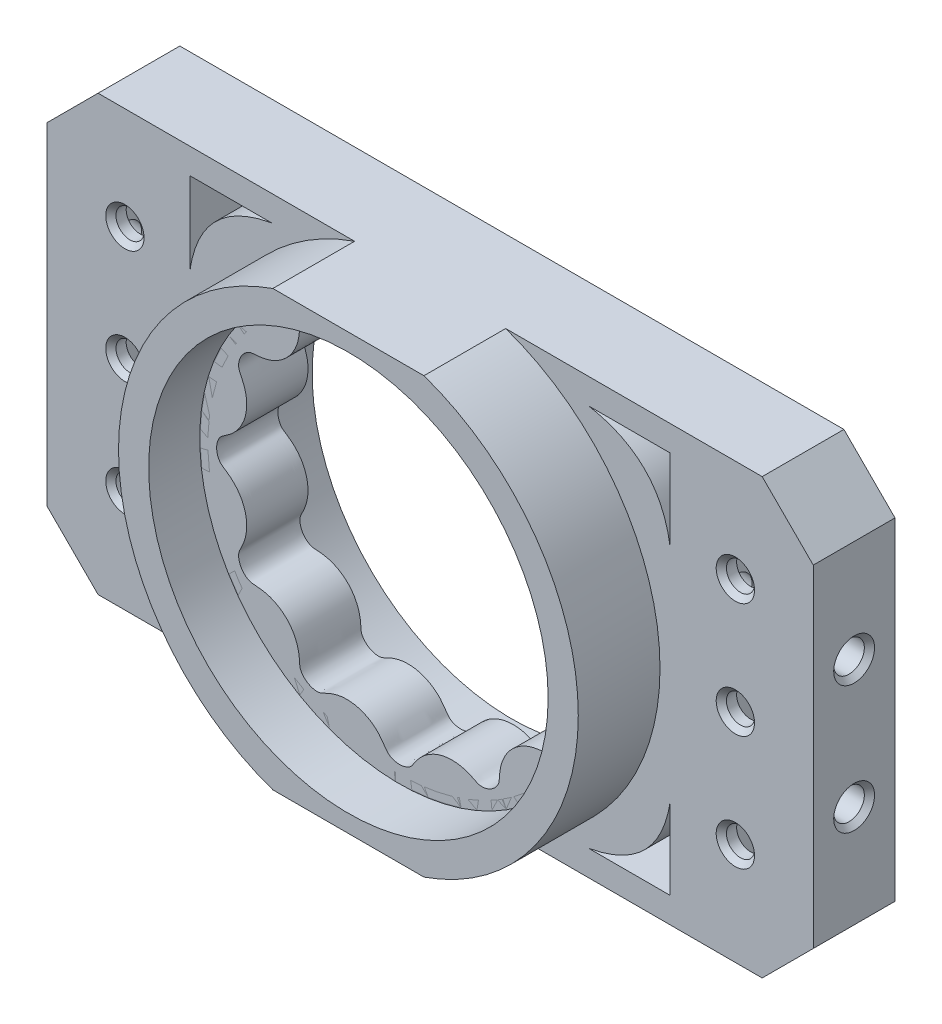
from build123d import *

# Parameters (mm, degrees)
ESQUISSE1_W              = 150
ESQUISSE1_H              = 85
ESQUISSE1_R              = 39.1
BOSS_EXTRU_2_DEPTH       = 32
ESQUISSE3_R              = 39.1
BOSS_EXTRU_3_DEPTH       = 12
ESQUISSE4_R              = 39
ESQUISSE4_R_2            = 37.5
BOSS_EXTRU_4_DEPTH       = 12
ENL_V_MAT_EXTRU_2_DEPTH  = 16
CHANFREIN1_SIZE          = 10
ESQUISSE8_W              = 15.5
ESQUISSE8_H              = 70
ENL_V_MAT_EXTRU_4_DEPTH  = 13
ESQUISSE10_R             = 2.75
ENL_V_MAT_EXTRU_5_DEPTH  = 11
ESQUISSE11_R             = 3
ENL_V_MAT_EXTRU_6_DEPTH  = 29
ENL_V_START              = -29
ESQUISSE12_R             = 3
ENL_V_MAT_EXTRU_7_DEPTH  = 29
CHANFREIN3_SIZE          = 1
ESQUISSE13_R             = 2
ENL_V_MAT_EXTRU_8_DEPTH  = 10
ENL_V_MAT_EXTRU_9_DEPTH  = 37
ENL_V_START_2            = -12
ENL_V_MAT_EXTRU_10_DEPTH = 12


# Read off the part's stored shape, not the designer's step: Enlèv. mat.-Extru.10
with BuildPart() as part:
    # Esquisse1 → Boss.-Extru.2 (new body)
    with BuildSketch(Plane.XY):
        Rectangle(ESQUISSE1_W, ESQUISSE1_H)
        Circle(ESQUISSE1_R, mode=Mode.SUBTRACT)
    extrude(amount=BOSS_EXTRU_2_DEPTH)

    # Esquisse7 → Enlèv. mat.-Extru.2 (cut)
    with BuildSketch(Plane.XY.offset(32)):
        with BuildLine():
            Line((14.790199458, 42.5), (75, 42.5))
            Line((75, 42.5), (75, -42.5))
            Line((75, -42.5), (14.790199458, -42.5))
            ThreePointArc((14.790199458, -42.5), (45, 0), (14.790199458, 42.5))
        make_face()
        with BuildLine():
            Line((-75, 42.5), (-14.790199458, 42.5))
            ThreePointArc((-14.790199458, 42.5), (-45, 0), (-14.790199458, -42.5))
            Line((-14.790199458, -42.5), (-75, -42.5))
            Line((-75, -42.5), (-75, 42.5))
        make_face()
    extrude(amount=-ENL_V_MAT_EXTRU_2_DEPTH, mode=Mode.SUBTRACT)

    # Chanfrein1
    chanfrein1_edges = [part.edges().sort_by_distance(p)[0] for p in [
        (-75, -42.5, 8),
        (-75, 42.5, 8),
        (75, 42.5, 8),
        (75, -42.5, 8),
    ]]
    chamfer(chanfrein1_edges, length=CHANFREIN1_SIZE)

    # Esquisse8 → Enlèv. mat.-Extru.4 (cut)
    with BuildSketch(Plane(origin=(0, 0, 0), x_dir=(-1, 0, 0), z_dir=(0, 0, -1))):
        with Locations((-59.75, 0)):
            Rectangle(ESQUISSE8_W, ESQUISSE8_H)
        with Locations((59.75, 0)):
            Rectangle(ESQUISSE8_W, ESQUISSE8_H)
    extrude(amount=-ENL_V_MAT_EXTRU_4_DEPTH, mode=Mode.SUBTRACT)

    # Esquisse10 → Enlèv. mat.-Extru.5 (cut)
    with BuildSketch(Plane(origin=(0, 0, 13), x_dir=(-1, 0, 0), z_dir=(0, 0, -1))):
        with Locations((-59.75, 22.5)):
            Circle(ESQUISSE10_R)
        with Locations((-59.75, 0)):
            Circle(ESQUISSE10_R)
        with Locations(Location((-59.75, -22.5, 0), (0, 0, 180))):
            Circle(ESQUISSE10_R)
        with Locations(Location((59.75, 22.5, 0), (0, 0, 180))):
            Circle(ESQUISSE10_R)
        with Locations(Location((59.75, 0, 0), (0, 0, 180))):
            Circle(ESQUISSE10_R)
        with Locations((59.75, -22.5)):
            Circle(ESQUISSE10_R)
    extrude(amount=-ENL_V_MAT_EXTRU_5_DEPTH, mode=Mode.SUBTRACT)

    # Esquisse11 → Enlèv. mat.-Extru.6 (cut)
    with BuildSketch(Plane(origin=(75, 0, 0), x_dir=(0, 0, -1), z_dir=(1, 0, 0))):
        with Locations(Location((-8, 12.5, 0), (0, 0, 90))):
            Circle(ESQUISSE11_R)
        with Locations(Location((-8, -12.5, 0), (0, 0, 90))):
            Circle(ESQUISSE11_R)
    extrude(amount=-ENL_V_MAT_EXTRU_6_DEPTH, mode=Mode.SUBTRACT)

    # Esquisse12 → Enlèv. mat.-Extru.7 (cut)
    with BuildSketch(Plane.ZY.offset(75).offset(ENL_V_START)):
        with Locations(Location((8, 12.5, 0), (0, 0, 90))):
            Circle(ESQUISSE12_R)
        with Locations(Location((8, -12.5, 0), (0, 0, 90))):
            Circle(ESQUISSE12_R)
    extrude(amount=ENL_V_MAT_EXTRU_7_DEPTH, mode=Mode.SUBTRACT)

    # Chanfrein3
    chanfrein3_edges = [part.edges().sort_by_distance(p)[0] for p in [
        (62.5, 0, 16),
        (57, -22.5, 16),
        (-62.5, 22.5, 16),
        (-62.5, 0, 16),
        (-57, -22.5, 16),
        (62.5, 22.5, 16),
        (75, 9.5, 8),
        (75, -15.5, 8),
        (-75, 9.5, 8),
        (-75, -15.5, 8),
    ]]
    chamfer(chanfrein3_edges, length=CHANFREIN3_SIZE)

    # Esquisse13 → Enlèv. mat.-Extru.8 (cut)
    with BuildSketch(Plane(origin=(0, 0, 0), x_dir=(-1, 0, 0), z_dir=(0, 0, -1))):
        with Locations((-47.299047409, 0.206340622)):
            Circle(ESQUISSE13_R)
        with Locations((47.299047409, -0.206340622)):
            Circle(ESQUISSE13_R)
    extrude(amount=-ENL_V_MAT_EXTRU_8_DEPTH, mode=Mode.SUBTRACT)

    # Esquisse14 → Enlèv. mat.-Extru.9 (cut)
    with BuildSketch(Plane(origin=(0, 0, 0), x_dir=(-1, 0, 0), z_dir=(0, 0, -1))):
        with BuildLine():
            Line((-47, 37.5), (-31, 37.5))
            add(Edge.make_bspline(
                [(-47, 21.5), (-45, 35), (-31, 37.5)],
                knots=[0, 0, 0, 0.553542999, 0.553542999, 0.553542999], degree=2))
            Line((-47, 21.5), (-47, 37.5))
        make_face()
        with BuildLine():
            Line((-47, -37.5), (-31, -37.5))
            add(Edge.make_bspline(
                [(-47, -21.5), (-45, -35), (-31, -37.5)],
                knots=[0, 0, 0, 0.553542999, 0.553542999, 0.553542999], degree=2))
            Line((-47, -21.5), (-47, -37.5))
        make_face()
        with BuildLine():
            Line((47, -37.5), (47, -21.5))
            add(Edge.make_bspline(
                [(47, -21.5), (45, -35), (31, -37.5)],
                knots=[0, 0, 0, 0.553542999, 0.553542999, 0.553542999], degree=2))
            Line((31, -37.5), (47, -37.5))
        make_face()
        with BuildLine():
            Line((47, 37.5), (31, 37.5))
            add(Edge.make_bspline(
                [(47, 21.5), (45, 35), (31, 37.5)],
                knots=[0, 0, 0, 0.553542999, 0.553542999, 0.553542999], degree=2))
            Line((47, 21.5), (47, 37.5))
        make_face()
    extrude(amount=-ENL_V_MAT_EXTRU_9_DEPTH, mode=Mode.SUBTRACT)


with BuildPart() as body_2:
    # Esquisse3 → Boss.-Extru.3 (new body)
    with BuildSketch(Plane.XY.offset(10)):
        Circle(ESQUISSE3_R)
    extrude(amount=BOSS_EXTRU_3_DEPTH)

    # Enlèv. mat.-Extru.10 outline → Enlèv. mat.-Extru.10 (cut)
    with BuildSketch(Plane.XY.offset(22).offset(ENL_V_START_2)):
        with BuildLine():
            Line((35.789890768, -0.029077947), (35.79, 0))
            add(Edge.make_bspline(
                [(35.79, 0), (35.79, 0.127639257), (35.778773221, 0.332778615), (35.751800956, 0.550165303), (35.708661066, 0.806297374), (35.637092462, 1.089154863), (35.518929188, 1.420366645), (35.377797584, 1.713768291), (35.247271338, 1.925540597), (35.137539018, 2.07532933), (35.057864121, 2.172252362), (34.9697529, 2.268034114), (34.891049162, 2.344192302), (34.801897946, 2.421729875), (34.69946496, 2.501431646), (34.596030594, 2.575439949), (34.500719143, 2.640565416), (34.318289008, 2.760845312), (34.02375405, 2.954451504), (33.701874887, 3.177905887), (33.383346306, 3.408429746), (32.981888377, 3.733470258), (32.531197085, 4.133377044), (31.871067649, 4.796975418), (31.068067937, 5.947587573), (30.472373317, 7.133452491), (30.061603701, 8.481846392), (29.888749816, 9.803379457), (29.914580672, 10.998511079), (30.102609971, 12.237438542), (30.382060144, 13.143621741), (30.636801119, 13.792630936), (30.816186498, 14.187427774), (30.943376886, 14.451879211), (31.0689779, 14.704292097), (31.161104553, 14.887140556), (31.2318527, 15.032338739), (31.278096351, 15.132052587), (31.323132219, 15.235489538), (31.362248496, 15.336628462), (31.398692502, 15.448320134), (31.429003266, 15.562819921), (31.454028522, 15.684822556), (31.479702439, 15.858919885), (31.495635281, 16.099637434), (31.482672589, 16.416961113), (31.433749716, 16.753910576), (31.34708099, 17.100368066), (31.181426931, 17.562942897), (30.943240717, 18.009153182), (30.647260345, 18.409401982), (30.402285687, 18.680583556), (30.14127001, 18.917288139), (29.872471771, 19.11533163), (29.605887647, 19.271728853), (29.393589263, 19.367188973), (29.234529458, 19.423681926), (29.119044093, 19.457587012), (29.003119698, 19.484459665), (28.906210279, 19.501477295), (28.806535958, 19.514652758), (28.714282036, 19.5244974), (28.592052543, 19.534654342), (28.42338179, 19.545849621), (28.172284799, 19.559711481), (27.832755677, 19.582540906), (27.466980271, 19.615253244), (26.929513883, 19.678606682), (26.007949438, 19.859369436), (24.480873664, 20.32540815), (22.133767779, 21.835393957), (20.769553097, 23.717778361), (20.188745435, 25.008264309), (19.863427201, 25.99165496), (19.699659602, 26.804732782), (19.62072513, 27.405174555), (19.586431757, 27.785673237), (19.561270963, 28.142953682), (19.54704536, 28.404004221), (19.535490733, 28.579954578), (19.524972142, 28.70930536), (19.5153958, 28.800535112), (19.502752617, 28.897829516), (19.484875266, 29.001211669), (19.458858121, 29.114046792), (19.425241788, 29.22977198), (19.369024421, 29.389032777), (19.274379562, 29.600724405), (19.11875834, 29.867272371), (18.921506453, 30.136098434), (18.68549984, 30.397370908), (18.414950793, 30.642712051), (18.015371832, 30.939368383), (17.569580645, 31.178417899), (17.107108897, 31.345029218), (16.760554766, 31.432432917), (16.423340885, 31.482075198), (16.10552067, 31.495704603), (15.864311796, 31.480249261), (15.689680439, 31.454878917), (15.567439252, 31.430085323), (15.452573139, 31.399939552), (15.341189665, 31.363875073), (15.240261721, 31.325068493), (15.138894908, 31.281156682), (15.041278656, 31.236131671), (14.900097358, 31.167410075), (14.689678306, 31.062100064), (14.354835126, 30.893629354), (13.865243952, 30.668960177), (13.272972598, 30.428393217), (12.425347818, 30.15426356), (11.326281988, 29.953102301), (9.82258172, 29.849558178), (7.95986682, 30.135810078), (6.293648235, 30.868825703), (4.988230142, 31.703300007), (4.090869453, 32.560781852), (3.527967775, 33.225694405), (3.220050937, 33.641187129), (2.955599108, 34.021355477), (2.775563917, 34.297067147), (2.658750246, 34.473498073), (2.579075117, 34.590483775), (2.499833919, 34.701526095), (2.426476608, 34.796198343), (2.350145031, 34.884566755), (2.267482311, 34.970231929), (2.178034627, 35.052870462), (2.078668721, 35.134895634), (1.930920344, 35.243676206), (1.719281302, 35.374895996), (1.425877786, 35.516393683), (1.100164649, 35.634098935), (0.63289154, 35.75181763), (0.007401252, 35.81466098), (-0.618690388, 35.754165123), (-1.086953523, 35.638110645), (-1.413833808, 35.521429897), (-1.708608833, 35.380734486), (-1.921589084, 35.249899691), (-2.070392386, 35.141317841), (-2.170861559, 35.059121469), (-2.261050712, 34.976483283), (-2.343304938, 34.892068534), (-2.421254458, 34.802491622), (-2.492418477, 34.711457355), (-2.567715082, 34.606717765), (-2.644312458, 34.494894578), (-2.754751516, 34.328819924), (-2.915999601, 34.081599588), (-3.146975811, 33.744763494), (-3.416581941, 33.370331804), (-3.882758231, 32.799274615), (-4.720392282, 31.910394851), (-6.316892237, 30.800843837), (-8.024209241, 30.17283188), (-9.412330545, 29.914545771), (-10.677673335, 29.891721388), (-11.98007126, 30.042533549), (-12.814391996, 30.278561565), (-13.355852179, 30.465819904), (-13.813307943, 30.646708344), (-14.255420974, 30.847002461), (-14.626366422, 31.029030956), (-14.895539037, 31.165105725), (-15.027898274, 31.229975475), (-15.117098477, 31.271526259), (-15.226844092, 31.319562608), (-15.336650035, 31.362189146), (-15.445017017, 31.397732004), (-15.555219431, 31.427227275), (-15.680827522, 31.45329776), (-15.854573681, 31.479259788), (-16.092675439, 31.495510304), (-16.411211703, 31.483226588), (-16.746987126, 31.435092935), (-17.093637231, 31.349123817), (-17.556369229, 31.184378261), (-18.114604594, 30.887875604), (-18.596491022, 30.494229721), (-18.912934407, 30.14655411), (-19.112191918, 29.877249569), (-19.268894828, 29.611333834), (-19.364897726, 29.399157094), (-19.422831966, 29.237286254), (-19.456665107, 29.122612158), (-19.482308097, 29.013490513), (-19.500982775, 28.90854568), (-19.514721442, 28.806692535), (-19.524489857, 28.716275072), (-19.532889269, 28.617578468), (-19.543936891, 28.450532931), (-19.558187597, 28.188953448), (-19.581617308, 27.853371052), (-19.605689052, 27.563389815), (-19.665938994, 27.023408918), (-19.815911629, 26.184793134), (-20.157318959, 25.004337248), (-20.843954437, 23.653848589), (-21.907442667, 22.173569415), (-23.366068199, 20.981254776), (-24.729875334, 20.299797727), (-25.809319409, 19.908550701), (-26.681320067, 19.720412005), (-27.329223187, 19.628680558), (-27.736877407, 19.590346612), (-28.112211774, 19.563014677), (-28.382726945, 19.548308881), (-28.571483796, 19.536082551), (-28.700131212, 19.525824509), (-28.79357287, 19.516211471), (-28.89378403, 19.503380006), (-28.996103178, 19.485881398), (-29.10987875, 19.459951447), (-29.225176726, 19.426706738), (-29.34451178, 19.384879841), (-29.468665803, 19.333436849), (-29.640172161, 19.251114123), (-29.861998465, 19.122204031), (-30.130954944, 18.925694153), (-30.392436134, 18.690413161), (-30.638152972, 18.420492386), (-30.935488982, 18.021575487), (-31.175393775, 17.576220092), (-31.34296248, 17.113849239), (-31.431102317, 16.767207226), (-31.481463681, 16.42971509), (-31.4957654, 16.111462267), (-31.480769426, 15.869602066), (-31.455756173, 15.694752007), (-31.431086617, 15.571759024), (-31.40127822, 15.457172944), (-31.36534065, 15.345320051), (-31.327156613, 15.245460908), (-31.284090449, 15.145446195), (-31.239676797, 15.048766117), (-31.175818718, 14.917264592), (-31.068186275, 14.701173957), (-30.917280913, 14.403594033), (-30.696544325, 13.926689145), (-30.472211568, 13.390878907), (-30.15950348, 12.456530632), (-29.810946142, 10.730225838), (-30.064689862, 7.899926921), (-31.318948675, 5.426682654), (-32.435505386, 4.20878597), (-33.13999565, 3.59521888), (-33.584832875, 3.260315014), (-33.997977, 2.970889914), (-34.26821336, 2.794741742), (-34.465534156, 2.66394032), (-34.583531573, 2.583900852), (-34.697391976, 2.502995303), (-34.790793135, 2.430824615), (-34.882336437, 2.352216562), (-34.966665648, 2.271100102), (-35.049545251, 2.181842203), (-35.131851143, 2.082557104), (-35.240493763, 1.93564611), (-35.372005815, 1.724543039), (-35.513839403, 1.431924113), (-35.632092679, 1.106708259), (-35.750617163, 0.640010532), (-35.814640989, 0.014763145), (-35.755322825, -0.611565711), (-35.640088635, -1.080369209), (-35.523946323, -1.407769949), (-35.383629297, -1.703270447), (-35.253013755, -1.916896218), (-35.144474765, -2.066297321), (-35.062389745, -2.167084178), (-34.979546359, -2.25788197), (-34.895587666, -2.340059563), (-34.806035847, -2.418326934), (-34.716245766, -2.48880254), (-34.613711332, -2.562791766), (-34.505156163, -2.637397458), (-34.344561813, -2.744409737), (-34.110801882, -2.896806323), (-33.787525171, -3.117036587), (-33.441500377, -3.36430582), (-32.904011705, -3.79028071), (-32.210945892, -4.431178925), (-31.446053197, -5.377937961), (-30.607991425, -6.72355325), (-29.997666198, -8.529921388), (-29.878015885, -10.308985872), (-29.991732291, -11.746712679), (-30.285047246, -12.865829628), (-30.568457782, -13.632179159), (-30.775906261, -14.100407706), (-30.896993107, -14.356172467), (-31.040496863, -14.649263588), (-31.155464883, -14.876248427), (-31.227379711, -15.022559806), (-31.268924506, -15.111351799), (-31.317221413, -15.22107021), (-31.359968329, -15.330486891), (-31.396787168, -15.441883798), (-31.426420105, -15.551797401), (-31.452161795, -15.674366858), (-31.478661208, -15.849145458), (-31.495460108, -16.087814858), (-31.48386322, -16.403887088), (-31.436294764, -16.740835121), (-31.351138722, -17.086913053), (-31.18744962, -17.549512126), (-30.891899758, -18.108582824), (-30.499044995, -18.591313694), (-30.151567066, -18.908814845), (-29.882893308, -19.108441371), (-29.6160486, -19.266453889), (-29.403382202, -19.363177977), (-29.243327728, -19.420827789), (-29.127704923, -19.45527329), (-29.013669148, -19.482312531), (-28.913975927, -19.500211053), (-28.81821181, -19.513277667), (-28.731525722, -19.522830618), (-28.61726108, -19.532729401), (-28.449246476, -19.544244963), (-28.226103439, -19.556744808), (-27.923233777, -19.576222455), (-27.603803462, -19.601708126), (-27.112470284, -19.654287113), (-26.353245612, -19.783202192), (-25.049428282, -20.116121167), (-23.240800751, -21.047007284), (-21.86638758, -22.293709959), (-21.004561724, -23.39697238), (-20.430700942, -24.436535974), (-19.970600305, -25.585062525), (-19.743928101, -26.540921335), (-19.633605636, -27.282444585), (-19.596702715, -27.670593696), (-19.56597939, -28.054518992), (-19.548177295, -28.376924724), (-19.53585915, -28.577059258), (-19.527413149, -28.684759033), (-19.517842903, -28.77986412), (-19.504146955, -28.888089073), (-19.485719167, -28.996731103), (-19.461451493, -29.104155066), (-19.428803137, -29.218603234), (-19.386078204, -29.34129708), (-19.335401529, -29.46426633), (-19.254385951, -29.63403255), (-19.125257179, -29.857339816), (-18.929938438, -30.12569522), (-18.695402763, -30.387417906), (-18.425908503, -30.633673038), (-18.027874016, -30.931534818), (-17.58272221, -31.17241214), (-17.120584948, -31.340886757), (-16.774097519, -31.42970182), (-16.43582711, -31.480874051), (-16.11715006, -31.495810118), (-15.876018051, -31.481376548), (-15.699115839, -31.456490866), (-15.574680951, -31.431787824), (-15.462476382, -31.402842673), (-15.353215345, -31.368020382), (-15.248022286, -31.328150648), (-15.144529793, -31.283831825), (-15.05885294, -31.244624081), (-14.944559613, -31.189448915), (-14.730479024, -31.081546938), (-14.39268809, -30.913808211), (-14.026789203, -30.741547305), (-13.478251331, -30.506018228), (-12.636401368, -30.21270078), (-11.34439868, -29.918886727), (-9.726712469, -29.890750251), (-7.89732145, -30.152636069), (-6.192891366, -30.886669183), (-5.020489356, -31.719244854), (-4.229007445, -32.417244004), (-3.670993957, -33.047605471), (-3.298456821, -33.531506611), (-2.999665125, -33.955389597), (-2.801370681, -34.257671145), (-2.674608735, -34.449678253), (-2.588450789, -34.57696342), (-2.527257759, -34.663380221), (-2.478244919, -34.729277989), (-2.420459035, -34.802828997), (-2.35535137, -34.878841754), (-2.274381951, -34.963441835), (-2.185415977, -35.046402131), (-2.086670476, -35.128619532), (-1.940185611, -35.237433417), (-1.729872438, -35.369053471), (-1.437908616, -35.511303448), (-1.113253374, -35.630069187), (-0.647108873, -35.749409029), (-0.0221246, -35.814605679), (0.604438741, -35.756466353), (1.073780012, -35.642055662), (1.401723308, -35.526438449), (1.69787171, -35.386547214), (1.912257647, -35.256072056), (2.062139825, -35.147669966), (2.163362421, -35.065588031), (2.254592115, -34.982722842), (2.336945949, -34.898943617), (2.415330125, -34.809643134), (2.485212785, -34.721005437), (2.558341811, -34.61997875), (2.629455425, -34.516987824), (2.73621838, -34.356764135), (2.879898284, -34.137160518), (3.083041138, -33.836266666), (3.324037627, -33.496879076), (3.699351143, -33.012548829), (4.295935003, -32.347685244), (5.126908897, -31.635867869), (6.337688295, -30.805173616), (8.55713609, -29.910844664), (11.239558685, -29.874045167), (12.711513098, -30.238127255), (13.536702603, -30.529411692), (14.020209079, -30.738802871), (14.346938604, -30.892061691), (14.630542584, -31.031919222), (14.846338792, -31.140712481), (15.003715387, -31.218155106), (15.111319494, -31.268711213), (15.220035367, -31.316779934), (15.323321962, -31.35746268), (15.435444326, -31.394836748), (15.549047614, -31.425725131), (15.670304419, -31.451417544), (15.842878283, -31.4780099), (16.08199517, -31.495352744), (16.397888888, -31.484382679), (16.733984669, -31.437616322), (17.080137297, -31.353157211), (17.5430005, -31.190361087), (18.102353959, -30.896000906), (18.58613264, -30.503858238), (18.904548719, -30.156728254), (19.104963678, -29.888110834), (19.263798358, -29.621136818), (19.361195927, -29.408175269), (19.419299229, -29.24796039), (19.454137734, -29.131949027), (19.481342622, -29.01828544), (19.499430394, -28.918804441), (19.512541131, -28.824149296), (19.522065445, -28.739156102), (19.53192012, -28.627831837), (19.543352907, -28.463363886), (19.555234919, -28.253812672), (19.573385788, -27.962949522), (19.597193966, -27.65784334), (19.641597846, -27.2107822), (19.757903642, -26.485763732), (20.029321844, -25.321758298), (20.833784314, -23.57610941), (21.983967377, -22.171879707), (23.04030912, -21.25025454), (24.135382687, -20.576692291), (25.363351526, -20.037530023), (26.204461883, -19.822415164), (26.775208289, -19.710325621), (27.266147948, -19.636407817), (27.632194529, -19.60002509), (28.012413287, -19.568959244), (28.352469774, -19.549435727), (28.565850432, -19.536599409), (28.679703319, -19.527853508), (28.773373024, -19.518593768), (28.881812855, -19.505109352), (28.990976267, -19.486834057), (29.101676455, -19.462078795), (29.214297523, -19.430176801), (29.334884962, -19.38851294), (29.45945333, -19.337499101), (29.630309593, -19.256374492), (29.851135917, -19.129274163), (30.120703699, -18.93398029), (30.382665482, -18.700084622), (30.628931128, -18.431642709), (30.927726747, -18.033909021), (31.169279014, -17.589536191), (31.338779727, -17.127371255), (31.428442843, -16.780248185), (31.480168402, -16.443005669), (31.495821544, -16.122595979), (31.481855568, -15.880851072), (31.457602737, -15.705831879), (31.432693851, -15.578724269), (31.403613917, -15.465148672), (31.370052443, -15.359020785), (31.330432021, -15.2538121), (31.286453991, -15.150505676), (31.246748875, -15.063312836), (31.195434442, -14.956721442), (31.09452457, -14.755642195), (30.93108509, -14.429644798), (30.761085448, -14.067302993), (30.591139207, -13.683325824), (30.402075094, -13.179640924), (30.207506862, -12.576108784), (29.96671082, -11.612060497), (29.877643627, -10.141078209), (29.999742097, -8.785281944), (30.364440264, -7.424282386), (30.903321567, -6.234330971), (31.527920538, -5.265124222), (32.284631548, -4.357031751), (32.946837531, -3.754984119), (33.470342807, -3.342727527), (33.921937948, -3.022171377), (34.234895171, -2.81625967), (34.438555906, -2.682025262), (34.568833555, -2.594061698), (34.657433551, -2.531567823), (34.724691398, -2.48174456), (34.799098275, -2.423530021), (34.875347179, -2.358510744), (34.960376874, -2.277479282), (35.043074647, -2.189179663), (35.125491293, -2.090637483), (35.23433653, -1.944752201), (35.366100154, -1.73519457), (35.508606815, -1.444066733), (35.628052169, -1.120363453), (35.718921174, -0.765656345), (35.773795988, -0.413688745), (35.788940783, -0.155520074), (35.789890768, -0.029077947)],
                knots=[0.082669376, 0.082669376, 0.082669376, 0.082669376, 0.085929696, 0.087559856, 0.089190017, 0.092450337, 0.095710658, 0.098970978, 0.102231299, 0.103861459, 0.10549162, 0.10712178, 0.10875194, 0.1103821, 0.112012261, 0.112827341, 0.113642421, 0.114457501, 0.115272581, 0.115680121, 0.116087661, 0.116291432, 0.116495202, 0.116902742, 0.117106512, 0.117310282, 0.117514052, 0.117717822, 0.117921592, 0.118125362, 0.118532902, 0.118940442, 0.119347982, 0.119755522, 0.120163062, 0.120978142, 0.121793223, 0.122608303, 0.123423383, 0.125053543, 0.126683703, 0.128313864, 0.129944024, 0.131574184, 0.134834505, 0.138094825, 0.141355146, 0.144615467, 0.147875787, 0.154396428, 0.157656749, 0.160917069, 0.16417739, 0.167437711, 0.170698031, 0.173958352, 0.175588512, 0.177218672, 0.178848833, 0.180478993, 0.181294073, 0.182109153, 0.182924233, 0.183739313, 0.184554394, 0.184961934, 0.185369474, 0.185777014, 0.186184554, 0.186592094, 0.186999634, 0.187407174, 0.187610944, 0.187814714, 0.188222254, 0.188629794, 0.189037334, 0.189444874, 0.190259955, 0.191075035, 0.191890115, 0.192705195, 0.193520275, 0.195150436, 0.196780596, 0.198410756, 0.200040916, 0.203301237, 0.206561558, 0.209821878, 0.213082199, 0.216342519, 0.21960284, 0.226123481, 0.229383802, 0.232644122, 0.235904443, 0.239164763, 0.242425084, 0.244055244, 0.245685404, 0.247315565, 0.248945725, 0.250575885, 0.251390965, 0.252206046, 0.253021126, 0.253836206, 0.254651286, 0.255058826, 0.255466366, 0.255873906, 0.256077676, 0.256281446, 0.256688986, 0.256892756, 0.257096526, 0.257504067, 0.257911607, 0.258319147, 0.258726687, 0.259541767, 0.260356847, 0.261171927, 0.261987007, 0.263617168, 0.265247328, 0.266877488, 0.268507649, 0.270137809, 0.271767969, 0.27502829, 0.27828861, 0.281548931, 0.284809251, 0.291329893, 0.297850534, 0.301110854, 0.304371175, 0.307631495, 0.310891816, 0.312521976, 0.314152137, 0.315782297, 0.317412457, 0.319042617, 0.320672778, 0.321487858, 0.322302938, 0.323118018, 0.323933098, 0.324340638, 0.324748178, 0.325155719, 0.325563259, 0.325970799, 0.326174569, 0.326378339, 0.326582109, 0.326785879, 0.327193419, 0.327397189, 0.327600959, 0.328008499, 0.328823579, 0.329638659, 0.330453739, 0.33126882, 0.3320839, 0.33371406, 0.33534422, 0.336974381, 0.338604541, 0.340234701, 0.343495022, 0.346755342, 0.350015663, 0.353275984, 0.356536304, 0.363056945, 0.369577586, 0.372837907, 0.376098228, 0.379358548, 0.382618869, 0.384249029, 0.385879189, 0.38750935, 0.38913951, 0.38995459, 0.39076967, 0.39158475, 0.39239983, 0.393214911, 0.393622451, 0.394029991, 0.394437531, 0.394845071, 0.395252611, 0.395456381, 0.395660151, 0.396067691, 0.396271461, 0.396475231, 0.396882771, 0.397290311, 0.397697851, 0.398105391, 0.398920472, 0.399735552, 0.400550632, 0.401365712, 0.402180792, 0.403810952, 0.405441113, 0.407071273, 0.408701433, 0.410331594, 0.411961754, 0.415222075, 0.418482395, 0.421742716, 0.425003036, 0.428263357, 0.434783998, 0.438044319, 0.441304639, 0.44456496, 0.44782528, 0.451085601, 0.452715761, 0.454345921, 0.455976082, 0.457606242, 0.459236402, 0.460051482, 0.460866563, 0.461681643, 0.462496723, 0.463311803, 0.463719343, 0.464126883, 0.464534423, 0.464941963, 0.465349503, 0.465757043, 0.466164584, 0.466572124, 0.466979664, 0.467387204, 0.468202284, 0.469017364, 0.469832444, 0.470647524, 0.472277685, 0.473907845, 0.475538005, 0.477168165, 0.478798326, 0.480428486, 0.483688807, 0.486949127, 0.490209448, 0.493469768, 0.49999041, 0.506511051, 0.509771371, 0.513031692, 0.516292012, 0.519552333, 0.521182493, 0.522812654, 0.524442814, 0.526072974, 0.527703134, 0.529333295, 0.530148375, 0.530963455, 0.531778535, 0.532593615, 0.533001155, 0.533408695, 0.533816236, 0.534223776, 0.534427546, 0.534631316, 0.535038856, 0.535242626, 0.535446396, 0.535853936, 0.536261476, 0.536669016, 0.537076556, 0.537484096, 0.538299176, 0.539114256, 0.539929337, 0.540744417, 0.542374577, 0.544004737, 0.545634898, 0.547265058, 0.548895218, 0.552155539, 0.555415859, 0.55867618, 0.561936501, 0.565196821, 0.571717462, 0.578238103, 0.581498424, 0.584758745, 0.588019065, 0.591279386, 0.592909546, 0.594539706, 0.596169867, 0.597800027, 0.598615107, 0.599430187, 0.600245267, 0.601060347, 0.601875428, 0.602282968, 0.602690508, 0.603098048, 0.603505588, 0.603913128, 0.604320668, 0.604524438, 0.604728208, 0.604931978, 0.605135748, 0.605543288, 0.605950828, 0.606358368, 0.606765908, 0.607580989, 0.608396069, 0.609211149, 0.610026229, 0.610841309, 0.612471469, 0.61410163, 0.61573179, 0.61736195, 0.618992111, 0.620622271, 0.623882591, 0.627142912, 0.630403233, 0.633663553, 0.636923874, 0.643444515, 0.646704836, 0.649965156, 0.653225477, 0.656485797, 0.659746118, 0.661376278, 0.663006438, 0.664636599, 0.666266759, 0.667896919, 0.668711999, 0.66952708, 0.67034216, 0.67115724, 0.67197232, 0.67237986, 0.6727874, 0.67319494, 0.67360248, 0.67380625, 0.67401002, 0.67441756, 0.67462133, 0.674825101, 0.675232641, 0.675640181, 0.676047721, 0.676862801, 0.677677881, 0.678492961, 0.679308041, 0.680123121, 0.680938202, 0.682568362, 0.684198522, 0.685828682, 0.687458843, 0.689089003, 0.692349324, 0.695609644, 0.698869965, 0.702130285, 0.708650927, 0.715171568, 0.718431888, 0.721692209, 0.724952529, 0.72821285, 0.72984301, 0.731473171, 0.733103331, 0.734733491, 0.736363651, 0.737993812, 0.738808892, 0.739623972, 0.740439052, 0.741254132, 0.741661672, 0.742069212, 0.742476753, 0.742884293, 0.743088063, 0.743291833, 0.743699373, 0.744106913, 0.744514453, 0.744921993, 0.745329533, 0.745737073, 0.746144613, 0.746959693, 0.747774773, 0.748589854, 0.749404934, 0.751035094, 0.752665254, 0.754295415, 0.755925575, 0.757555735, 0.760816056, 0.764076376, 0.767336697, 0.770597017, 0.773857338, 0.780377979, 0.78689862, 0.790158941, 0.793419262, 0.796679582, 0.799939903, 0.801570063, 0.803200223, 0.804830384, 0.806460544, 0.807275624, 0.808090704, 0.808905784, 0.809720864, 0.810535945, 0.810943485, 0.811351025, 0.811758565, 0.812166105, 0.812573645, 0.812981185, 0.813184955, 0.813388725, 0.813592495, 0.813796265, 0.814203805, 0.814407575, 0.814611345, 0.815018885, 0.815426425, 0.816241506, 0.817056586, 0.817871666, 0.818686746, 0.819501826, 0.821131986, 0.822762147, 0.824392307, 0.826022467, 0.827652628, 0.829282788, 0.832543108, 0.835803429, 0.83906375, 0.84232407, 0.845584391, 0.852105032, 0.855365353, 0.858625673, 0.861885994, 0.865146314, 0.868406635, 0.870036795, 0.871666955, 0.873297116, 0.874927276, 0.876557436, 0.877372516, 0.878187597, 0.879002677, 0.879817757, 0.880632837, 0.881040377, 0.881447917, 0.881651687, 0.881855457, 0.882262997, 0.882466767, 0.882670537, 0.882874307, 0.883078077, 0.883281847, 0.883485617, 0.883893158, 0.884300698, 0.884708238, 0.885523318, 0.886338398, 0.887153478, 0.887968558, 0.888783638, 0.889598719, 0.891228879, 0.892859039, 0.894489199, 0.89611936, 0.89774952, 0.901009841, 0.904270161, 0.907530482, 0.910790802, 0.914051123, 0.917311443, 0.917311443, 0.917311443, 0.917311443], degree=3))
        make_face()
    extrude(amount=ENL_V_MAT_EXTRU_10_DEPTH, mode=Mode.SUBTRACT)


with BuildPart() as body_3:
    # Esquisse4 → Boss.-Extru.4 (new body)
    with BuildSketch(Plane.XY.offset(10)):
        Circle(ESQUISSE4_R)
        Circle(ESQUISSE4_R_2, mode=Mode.SUBTRACT)
    extrude(amount=BOSS_EXTRU_4_DEPTH)


solid = Compound([part.part, body_2.part, body_3.part])
